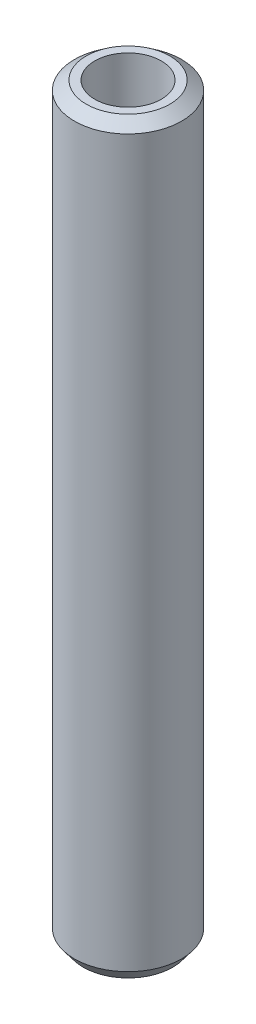
from build123d import *
from OCP.BRepFilletAPI import BRepFilletAPI_MakeChamfer

# Parameters (mm, degrees)
SKETCH1_R           = 22.5
BOSS_EXTRUDE1_DEPTH = 313.520818727
SKETCH2_R           = 13.980399899
CUT_EXTRUDE1_DEPTH  = 316.131407155
CHAMFER1_SIZE       = 3.724375185
CHAMFER1_SIZE2      = 4.935075091


with BuildPart() as part:
    # Sketch1 → Boss-Extrude1 (new body)
    with BuildSketch(Plane(origin=(0, 0, 0), x_dir=(1, 0, 0), z_dir=(0, 1, 0))):
        Circle(SKETCH1_R)
    extrude(amount=BOSS_EXTRUDE1_DEPTH)

    # Sketch2 → Cut-Extrude1 (cut, through all)
    with BuildSketch(Plane(origin=(0, 0, 0), x_dir=(1, 0, 0), z_dir=(0, 1, 0))):
        Circle(SKETCH2_R)
    extrude(amount=CUT_EXTRUDE1_DEPTH, mode=Mode.SUBTRACT)

    # Chamfer1: one chamfer whose edges measure the first distance from different faces: ONE call of the kernel's chamfer builder (chamfer() names one face for all edges)
    chamfer1_edges_1 = [part.edges().sort_by_distance(p)[0] for p in [
        (-22.5, 313.520818727, 0),
    ]]
    chamfer1_side_1 = [part.faces().sort_by_distance(p)[0] for p in [
        (-22.5, 156.760409363, 0),
    ]]
    chamfer1_edges_2 = [part.edges().sort_by_distance(p)[0] for p in [
        (-22.5, 0, 0),
    ]]
    chamfer1_side_2 = [part.faces().sort_by_distance(p)[0] for p in [
        (-21.863603897, 0, 0),
    ]]
    chamfer1 = BRepFilletAPI_MakeChamfer(part.part.solid().wrapped)
    for e in chamfer1_edges_1:
        chamfer1.Add(CHAMFER1_SIZE, CHAMFER1_SIZE2, e.wrapped, chamfer1_side_1[0].wrapped)  # the first distance lies on this face
    for e in chamfer1_edges_2:
        chamfer1.Add(CHAMFER1_SIZE, CHAMFER1_SIZE2, e.wrapped, chamfer1_side_2[0].wrapped)  # the first distance lies on this face
    add(Compound.cast(chamfer1.Shape()), mode=Mode.REPLACE)


solid = part.part
